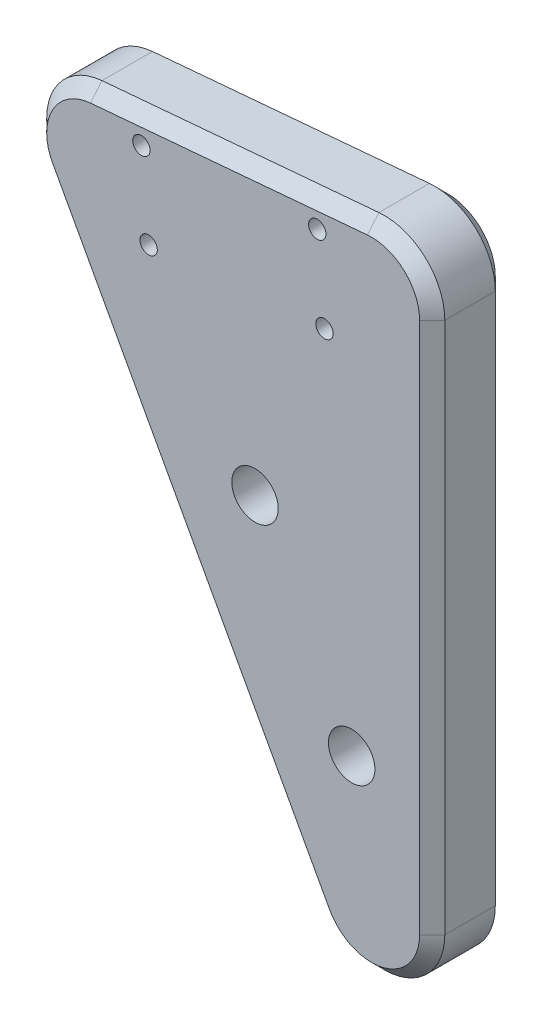
from build123d import *

# Parameters (mm, degrees)
SKETCH1_R           = 2.921
SKETCH1_R_2         = 1.0922
BOSS_EXTRUDE1_DEPTH = 9.525
FILLET1_R           = 7.62
CHAMFER1_SIZE       = 1.5875


with BuildPart() as part:
    # Sketch1 → Boss-Extrude1 (new body)
    with BuildSketch(Plane.XY):
        Polygon((0, 0), (54.714479363, -100.353454091), (54.714479363, 4.786896675), align=None)
        with Locations((44.587010065, -55.247724238)):
            Circle(SKETCH1_R, mode=Mode.SUBTRACT)
        with Locations((32.428236873, -32.946956662)):
            Circle(SKETCH1_R, mode=Mode.SUBTRACT)
        with Locations((40.257483915, -0.047509878)):
            Circle(SKETCH1_R_2, mode=Mode.SUBTRACT)
        with Locations((19.05, -12.35670409)):
            Circle(SKETCH1_R_2, mode=Mode.SUBTRACT)
        with Locations((41.16512382, -10.421881464)):
            Circle(SKETCH1_R_2, mode=Mode.SUBTRACT)
        with Locations((18.142360095, -1.982332504)):
            Circle(SKETCH1_R_2, mode=Mode.SUBTRACT)
    extrude(amount=BOSS_EXTRUDE1_DEPTH)

    # Fillet1
    fillet1_edges = [part.edges().sort_by_distance(p)[0] for p in [
        (54.714479363, -100.353454091, 4.7625),
        (0, 0, 4.7625),
        (54.714479363, 4.786896675, 4.7625),
    ]]
    fillet(fillet1_edges, radius=FILLET1_R)

    # Chamfer1
    chamfer1_edges = [part.edges().sort_by_distance(p)[0] for p in [
        (5.548863872, -2.975274703, 0),
        (22.989207497, -42.165189288, 0),
        (48.97661184, -77.842903003, 0),
        (54.714479363, -36.993938617, 0),
        (29.01531101, 2.538510782, 0),
        (52.242476745, 2.089179203, 0),
        (48.97661184, -77.842903003, 9.525),
        (22.989207497, -42.165189288, 9.525),
        (5.548863872, -2.975274703, 9.525),
        (29.01531101, 2.538510782, 9.525),
        (52.242476745, 2.089179203, 9.525),
        (54.714479363, -36.993938617, 9.525),
    ]]
    chamfer(chamfer1_edges, length=CHAMFER1_SIZE)


solid = part.part
